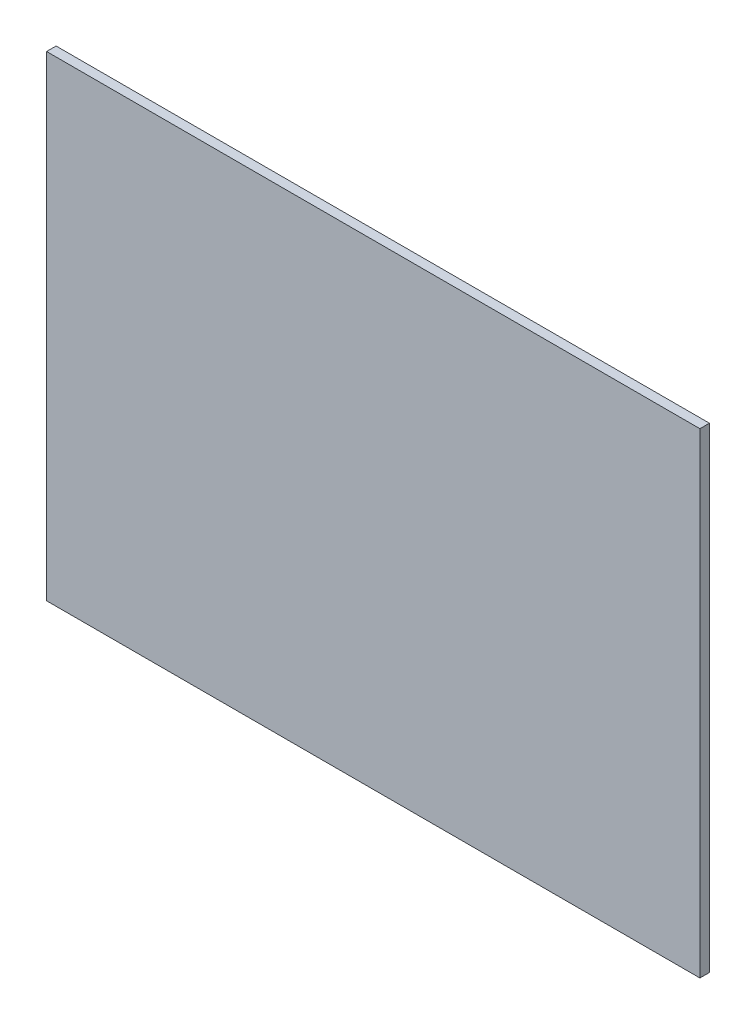
from build123d import *

# Parameters (mm, degrees)
SKETCH1_W           = 412
SKETCH1_H           = 300
BOSS_EXTRUDE1_DEPTH = 6


with BuildPart() as part:
    # Sketch1 → Boss-Extrude1 (new body)
    with BuildSketch(Plane.XY):
        with Locations((177.428571429, 127.104761905)):
            Rectangle(SKETCH1_W, SKETCH1_H)
    extrude(amount=BOSS_EXTRUDE1_DEPTH)


solid = part.part
